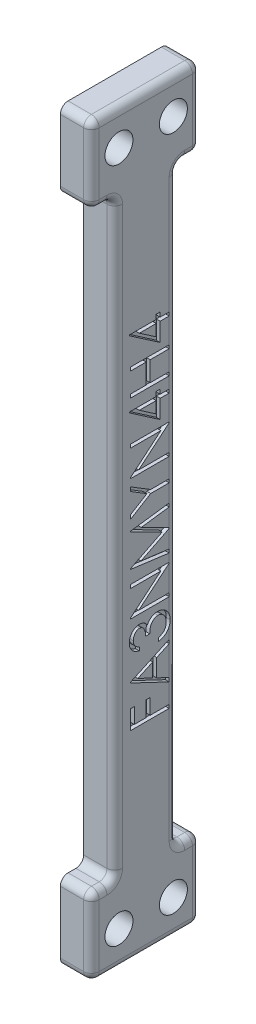
from build123d import *

# Parameters (mm, degrees)
BOSS_EXTRUDE1_DEPTH          = 4
FILLET1_R                    = 1
M3_CLEARANCE_HOLE1_OUTLINE_R = 1.8
M3_CLEARANCE_HOLE1_DEPTH     = 4
CUT_EXTRUDE1_DEPTH           = 0.5


# Read off the part's stored shape, not the designer's step: M3 Clearance Hole1
with BuildPart() as part:
    # Sketch1 → Boss-Extrude1 (new body)
    with BuildSketch(Plane.YZ):
        Polygon((-38, -4), (-38, -7), (-48, -7), (-48, 7), (-38, 7), (-38, 4), (38, 4), (38, 7), (48, 7), (48, -7), (38, -7), (38, -4), align=None)
    extrude(amount=BOSS_EXTRUDE1_DEPTH)

    # Fillet1
    fillet1_edges = [part.edges().sort_by_distance(p)[0] for p in [
        (4, 38, -5.5),
        (4, 43, -7),
        (4, 48, 0),
        (2, -38, -4),
        (2, -38, -7),
        (2, -48, -7),
        (2, -48, 7),
        (2, -38, 7),
        (2, -38, 4),
        (2, 38, 4),
        (2, 38, 7),
        (2, 48, 7),
        (2, 48, -7),
        (2, 38, -7),
        (2, 38, -4),
        (4, 43, 7),
        (4, 38, 5.5),
        (4, 0, 4),
        (4, -38, 5.5),
        (4, -43, 7),
        (4, -48, 0),
        (4, -43, -7),
        (4, 0, -4),
        (4, -38, -5.5),
    ]]
    fillet(fillet1_edges, radius=FILLET1_R)

    # M3 Clearance Hole1 outline → M3 Clearance Hole1 (cut)
    with BuildSketch(Plane.YZ):
        with Locations((43.5, -3.543403148)):
            Circle(M3_CLEARANCE_HOLE1_OUTLINE_R)
        with Locations((43.5, 3.456596852)):
            Circle(M3_CLEARANCE_HOLE1_OUTLINE_R)
        with Locations((-43.5, -3.543403148)):
            Circle(M3_CLEARANCE_HOLE1_OUTLINE_R)
        with Locations((-43.5, 3.456596852)):
            Circle(M3_CLEARANCE_HOLE1_OUTLINE_R)
    extrude(amount=M3_CLEARANCE_HOLE1_DEPTH, mode=Mode.SUBTRACT)

    # Sketch4 → Cut-Extrude1 (cut)
    # profile 1 of 10: a face of its own
    with BuildSketch(Plane.YZ.offset(4)):
        Polygon((-22.179487179, 2), (-19.743589744, 2), (-19.743589744, 1.487179487), (-21.730769231, 1.487179487), (-21.730769231, -0.051282051), (-19.743589744, -0.051282051), (-19.743589744, -0.564102564), (-21.730769231, -0.564102564), (-21.730769231, -3), (-22.179487179, -3), align=None)
    # profile 2 of 10: a face of its own
    with BuildSketch(Plane.YZ.offset(4)):
        Polygon((-16.794871795, 2), (-14.487179487, -3), (-14.974959936, -3), (-15.714142628, -1.397435897), (-17.980769231, -1.397435897), (-18.739983974, -3), (-19.230769231, -3), (-16.858974359, 2), align=None)
        Polygon((-16.83193109, 1.024439103), (-17.736378205, -0.884615385), (-15.950520833, -0.884615385), align=None, mode=Mode.SUBTRACT)
    # profile 3 of 10: a face of its own
    with BuildSketch(Plane.YZ.offset(4)):
        with BuildLine():
            Line((-13.397435897, 0.846153846), (-13.846153846, 0.846153846))
            add(Edge.make_bspline(
                [(-13.846153846, 0.846153846), (-13.833997345, 0.896485966), (-13.81023238, 0.994881144), (-13.760664418, 1.135462945), (-13.706665482, 1.268496547), (-13.641823904, 1.391490938), (-13.571097112, 1.506917942), (-13.490064653, 1.612159548), (-13.402465049, 1.709892356), (-13.305572265, 1.796625553), (-13.203959891, 1.875165166), (-13.096196148, 1.942129533), (-12.984449157, 1.999735466), (-12.867944682, 2.04719294), (-12.746335865, 2.082943688), (-12.620722117, 2.108881982), (-12.49077426, 2.125726431), (-12.402563416, 2.127370378), (-12.357772436, 2.128205128)],
                knots=[0, 0, 0, 0, 1.162005537, 2.271625781, 3.343758855, 4.383309926, 5.390229558, 6.379919256, 7.361854164, 8.333198761, 9.295911338, 10.242430842, 11.177959212, 12.116337295, 13.062827104, 14.020064771, 14.994644689, 16, 16, 16, 16], degree=3))
            add(Edge.make_bspline(
                [(-12.357772436, 2.128205128), (-12.292511376, 2.126234799), (-12.163412789, 2.12233712), (-11.973751293, 2.086745068), (-11.790855837, 2.03042345), (-11.61672834, 1.95260384), (-11.454987722, 1.856621964), (-11.311078884, 1.742386626), (-11.18695244, 1.612101909), (-11.082817615, 1.468198246), (-11.001281902, 1.314404661), (-10.941158511, 1.156118722), (-10.90455611, 0.993715906), (-10.899812457, 0.88406265), (-10.897435897, 0.829126603)],
                knots=[0, 0, 0, 0, 1.083050992, 2.142477498, 3.193116406, 4.255571735, 5.30263384, 6.308962982, 7.297363603, 8.282367274, 9.249857812, 10.179914175, 11.08814088, 12, 12, 12, 12], degree=3))
            add(Edge.make_bspline(
                [(-10.897435897, 0.829126603), (-10.89909817, 0.776259753), (-10.902350981, 0.672807532), (-10.92997056, 0.521776822), (-10.976450935, 0.379431679), (-11.040836311, 0.245172876), (-11.124181382, 0.119851676), (-11.225142378, 0.003186118), (-11.344431895, -0.105341251), (-11.434830378, -0.167511927), (-11.481370192, -0.199519231)],
                knots=[0, 0, 0, 0, 1.024540389, 2.004866551, 2.965041327, 3.920577974, 4.882998113, 5.874504559, 6.905732034, 8, 8, 8, 8], degree=3))
            add(Edge.make_bspline(
                [(-11.481370192, -0.199519231), (-11.428181971, -0.225202333), (-11.322800723, -0.276087987), (-11.179157109, -0.375881926), (-11.048760144, -0.491105279), (-10.976040546, -0.581023355), (-10.939503205, -0.626201923)],
                knots=[0, 0, 0, 0, 1.015518401, 2.012035669, 3.001164323, 4, 4, 4, 4], degree=3))
            add(Edge.make_bspline(
                [(-10.939503205, -0.626201923), (-10.915444145, -0.659141568), (-10.867720007, -0.724481449), (-10.808812102, -0.829533486), (-10.75537051, -0.935749899), (-10.71372734, -1.045977622), (-10.681478959, -1.15893907), (-10.658427484, -1.274828208), (-10.644107283, -1.393739668), (-10.642056494, -1.474186068), (-10.641025641, -1.514623397)],
                knots=[0, 0, 0, 0, 1.025084078, 2.033381695, 3.024893161, 4.013698104, 4.991890475, 5.976764909, 6.982997093, 8, 8, 8, 8], degree=3))
            add(Edge.make_bspline(
                [(-10.641025641, -1.514623397), (-10.643589232, -1.584637285), (-10.648704349, -1.724335573), (-10.694424455, -1.930728033), (-10.765300513, -2.13247875), (-10.865953279, -2.325442806), (-10.988621149, -2.505986208), (-11.134560183, -2.667523792), (-11.302112195, -2.806378941), (-11.488977408, -2.922393553), (-11.691430449, -3.015133441), (-11.907967009, -3.079501217), (-12.135467086, -3.121424074), (-12.291477511, -3.125919601), (-12.370793269, -3.128205128)],
                knots=[0, 0, 0, 0, 0.955779014, 1.907060117, 2.875433937, 3.871313158, 4.872415639, 5.851225146, 6.836215519, 7.83643374, 8.849228613, 9.86973379, 10.916971861, 12, 12, 12, 12], degree=3))
            add(Edge.make_bspline(
                [(-12.370793269, -3.128205128), (-12.424249412, -3.126964824), (-12.529433277, -3.124524318), (-12.684066846, -3.107840602), (-12.831669274, -3.077369166), (-12.972440128, -3.036364444), (-13.106504465, -2.984376241), (-13.233453187, -2.919635243), (-13.354067321, -2.843475955), (-13.46720868, -2.754999401), (-13.572863776, -2.656026058), (-13.668224811, -2.544798901), (-13.754881658, -2.423374038), (-13.830513999, -2.290341101), (-13.898566788, -2.147419305), (-13.954539584, -1.992778593), (-14.003804682, -1.827801419), (-14.026709631, -1.712833218), (-14.038461538, -1.653846154)],
                knots=[0, 0, 0, 0, 1.048658725, 2.063410685, 3.046034179, 4.001477787, 4.936774919, 5.862367409, 6.792675028, 7.730719943, 8.675894397, 9.627829632, 10.600096036, 11.597688215, 12.626045268, 13.701542398, 14.82072376, 16, 16, 16, 16], degree=3))
            Line((-14.038461538, -1.653846154), (-13.58974359, -1.653846154))
            add(Edge.make_bspline(
                [(-13.58974359, -1.653846154), (-13.578053173, -1.692344744), (-13.555314298, -1.767227847), (-13.516608158, -1.874999712), (-13.472510627, -1.973796931), (-13.425204114, -2.064344248), (-13.37552062, -2.147533394), (-13.31992787, -2.221164636), (-13.262543377, -2.288472067), (-13.219287158, -2.326392942), (-13.198116987, -2.344951923)],
                knots=[0, 0, 0, 0, 1.198163088, 2.33053128, 3.407730985, 4.417276592, 5.372219308, 6.28897303, 7.162600585, 8, 8, 8, 8], degree=3))
            add(Edge.make_bspline(
                [(-13.198116987, -2.344951923), (-13.170121878, -2.366535257), (-13.114218074, -2.409635303), (-13.023120601, -2.464637629), (-12.927313621, -2.512296237), (-12.824721229, -2.548701516), (-12.717557271, -2.579526746), (-12.604089606, -2.599698916), (-12.485319296, -2.613539161), (-12.404222491, -2.614760492), (-12.362780449, -2.615384615)],
                knots=[0, 0, 0, 0, 0.946170439, 1.889420265, 2.845303464, 3.807233317, 4.801018734, 5.828864929, 6.890507805, 8, 8, 8, 8], degree=3))
            add(Edge.make_bspline(
                [(-12.362780449, -2.615384615), (-12.315989731, -2.614504751), (-12.224494521, -2.612784251), (-12.090987579, -2.596961813), (-11.963976939, -2.573918365), (-11.84487276, -2.53832839), (-11.732114892, -2.494355745), (-11.627283964, -2.439143737), (-11.529003812, -2.374365563), (-11.438533233, -2.300738194), (-11.357182508, -2.220136058), (-11.285554632, -2.135831671), (-11.224662259, -2.048180486), (-11.175542861, -1.956697456), (-11.136756361, -1.861761415), (-11.110351789, -1.763105944), (-11.091992481, -1.661538421), (-11.090497321, -1.592497037), (-11.08974359, -1.557692308)],
                knots=[0, 0, 0, 0, 1.217147791, 2.380027433, 3.494444702, 4.572153297, 5.609568379, 6.639424714, 7.649109417, 8.668170816, 9.669597737, 10.625200337, 11.543417969, 12.441394052, 13.322311151, 14.205496177, 15.095365482, 16, 16, 16, 16], degree=3))
            add(Edge.make_bspline(
                [(-11.08974359, -1.557692308), (-11.091929735, -1.511104681), (-11.096291147, -1.41816124), (-11.129589118, -1.281421849), (-11.184358924, -1.149674116), (-11.26103394, -1.025165845), (-11.354370695, -0.9097717), (-11.463463419, -0.806812439), (-11.589218031, -0.721855166), (-11.704960701, -0.663157086), (-11.807482353, -0.623104121), (-11.895218617, -0.596425601), (-11.993442336, -0.573834664), (-12.100965691, -0.552817133), (-12.218598858, -0.534929493), (-12.346213769, -0.520012613), (-12.483836286, -0.50807684), (-12.57910938, -0.502746704), (-12.628205128, -0.5)],
                knots=[0, 0, 0, 0, 1.07054697, 2.135767047, 3.216561865, 4.33974944, 5.486079747, 6.621378074, 7.775625952, 8.963672916, 9.598146892, 10.304877434, 11.070270905, 11.915000392, 12.823868403, 13.805723172, 14.86925407, 16, 16, 16, 16], degree=3))
            Line((-12.628205128, -0.5), (-12.628205128, 0.012820513))
            add(Edge.make_bspline(
                [(-12.628205128, 0.012820513), (-12.56634632, 0.013870232), (-12.445180111, 0.015926375), (-12.268188247, 0.040794962), (-12.098940658, 0.075195859), (-11.941188169, 0.127888991), (-11.797404293, 0.189089415), (-11.672662004, 0.260306857), (-11.568708937, 0.339470784), (-11.486050263, 0.427803083), (-11.423865651, 0.522538865), (-11.378398798, 0.621276948), (-11.351541189, 0.724882749), (-11.34795595, 0.795589418), (-11.346153846, 0.831129808)],
                knots=[0, 0, 0, 0, 1.321986639, 2.589447074, 3.816329219, 5.01088745, 6.139805852, 7.153945165, 8.075214402, 8.924034688, 9.728124013, 10.488707548, 11.240355623, 12, 12, 12, 12], degree=3))
            add(Edge.make_bspline(
                [(-11.346153846, 0.831129808), (-11.346745862, 0.857240872), (-11.347923649, 0.909187597), (-11.362776903, 0.985080552), (-11.385096961, 1.058653332), (-11.415782289, 1.129593061), (-11.456854001, 1.197407738), (-11.506005411, 1.262675522), (-11.564531268, 1.325023778), (-11.631596193, 1.38313852), (-11.703613057, 1.438523144), (-11.782541307, 1.485542626), (-11.866001128, 1.525749857), (-11.954084921, 1.558906289), (-12.047078535, 1.583848129), (-12.144545046, 1.601756474), (-12.246670308, 1.612953124), (-12.316344211, 1.614565146), (-12.351762821, 1.615384615)],
                knots=[0, 0, 0, 0, 0.884392785, 1.759457502, 2.611959086, 3.489218968, 4.37281399, 5.2945488, 6.255912374, 7.266815255, 8.301784654, 9.332968512, 10.37626691, 11.440494194, 12.520033166, 13.637162961, 14.798855837, 16, 16, 16, 16], degree=3))
            add(Edge.make_bspline(
                [(-12.351762821, 1.615384615), (-12.408693775, 1.613396955), (-12.51989317, 1.609514593), (-12.680200194, 1.575510288), (-12.829227814, 1.521255883), (-12.943140195, 1.456494427), (-13.027258158, 1.392565236), (-13.087368069, 1.336733255), (-13.14639737, 1.274686364), (-13.200462623, 1.202602971), (-13.255139732, 1.125364699), (-13.304917677, 1.039045154), (-13.353288666, 0.945896019), (-13.382435166, 0.880045113), (-13.397435897, 0.846153846)],
                knots=[0, 0, 0, 0, 1.472543308, 2.876219568, 4.221790263, 5.565193594, 6.249813518, 6.953379497, 7.687249741, 8.463570142, 9.283606569, 10.136032583, 11.040678096, 12, 12, 12, 12], degree=3))
        make_face()
    # profile 4 of 10: a face of its own
    with BuildSketch(Plane.YZ.offset(4)):
        Polygon((-9.743589744, -3), (-9.743589744, 2), (-9.649439103, 2), (-6.346153846, -1.935296474), (-6.346153846, 2), (-5.897435897, 2), (-5.897435897, -3), (-5.999599359, -3), (-9.294871795, 0.926282051), (-9.294871795, -3), align=None)
    # profile 5 of 10: a face of its own
    with BuildSketch(Plane.YZ.offset(4)):
        Polygon((-4.871794872, -3), (-4.211738782, 2), (-4.147636218, 2), (-2.083333333, -2.102564103), (-0.025040064, 2), (0.0390625, 2), (0.705128205, -3), (0.256410256, -3), (-0.224358974, 0.594751603), (-2.028245192, -3), (-2.130408654, -3), (-3.942307692, 0.605769231), (-4.420072115, -3), align=None)
    # profile 6 of 10: a face of its own
    with BuildSketch(Plane.YZ.offset(4)):
        Polygon((1.346153846, 2), (1.859975962, 2), (3.172075321, -0.146434295), (4.485176282, 2), (5, 2), (3.397435897, -0.623197115), (3.397435897, -3), (2.948717949, -3), (2.948717949, -0.623197115), align=None)
    # profile 7 of 10: a face of its own
    with BuildSketch(Plane.YZ.offset(4)):
        Polygon((5.897435897, -3), (5.897435897, 2), (5.991586538, 2), (9.294871795, -1.935296474), (9.294871795, 2), (9.743589744, 2), (9.743589744, -3), (9.641426282, -3), (6.346153846, 0.926282051), (6.346153846, -3), align=None)
    # profile 8 of 10: a face of its own
    with BuildSketch(Plane.YZ.offset(4)):
        Polygon((13.306290064, 2.128205128), (13.397435897, 2.128205128), (13.397435897, -1.333333333), (13.974358974, -1.333333333), (13.974358974, -1.846153846), (13.397435897, -1.846153846), (13.397435897, -3), (12.948717949, -3), (12.948717949, -1.846153846), (10.576923077, -1.846153846), align=None)
        Polygon((12.948717949, -1.333333333), (12.948717949, 0.836137821), (11.459334936, -1.333333333), align=None, mode=Mode.SUBTRACT)
    # profile 9 of 10: a face of its own
    with BuildSketch(Plane.YZ.offset(4)):
        Polygon((14.871794872, 2), (15.320512821, 2), (15.320512821, -0.051282051), (17.884615385, -0.051282051), (17.884615385, 2), (18.333333333, 2), (18.333333333, -3), (17.884615385, -3), (17.884615385, -0.564102564), (15.320512821, -0.564102564), (15.320512821, -3), (14.871794872, -3), align=None)
    # profile 10 of 10: a face of its own
    with BuildSketch(Plane.YZ.offset(4)):
        Polygon((21.896033654, 2.128205128), (21.987179487, 2.128205128), (21.987179487, -1.333333333), (22.564102564, -1.333333333), (22.564102564, -1.846153846), (21.987179487, -1.846153846), (21.987179487, -3), (21.538461538, -3), (21.538461538, -1.846153846), (19.166666667, -1.846153846), align=None)
        Polygon((21.538461538, -1.333333333), (21.538461538, 0.836137821), (20.049078526, -1.333333333), align=None, mode=Mode.SUBTRACT)
    extrude(amount=-CUT_EXTRUDE1_DEPTH, mode=Mode.SUBTRACT)


solid = part.part
